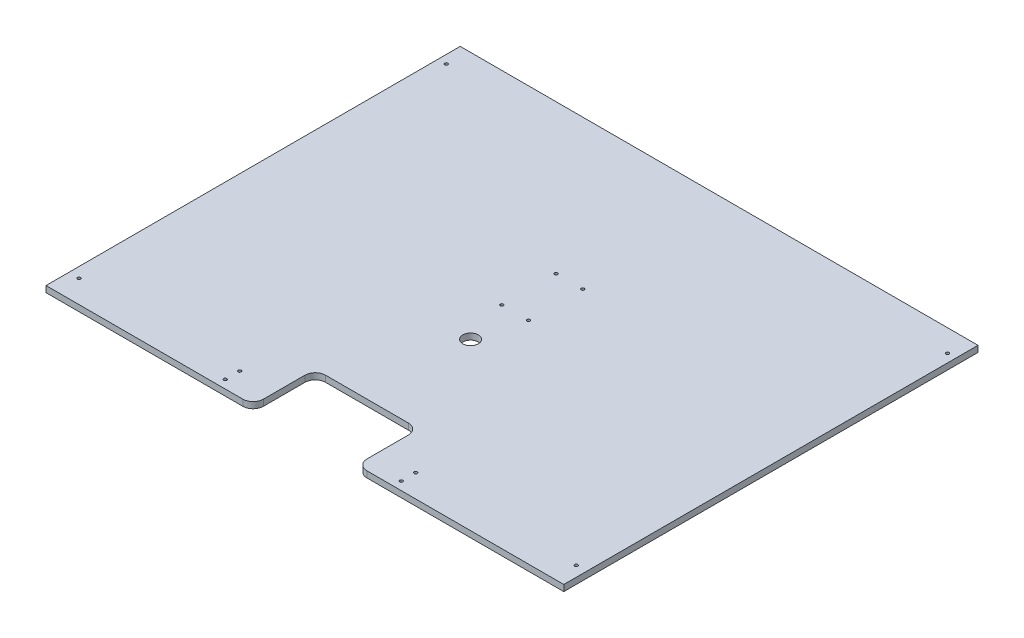
from build123d import *

# Parameters (mm, degrees)
SKETCH1_W           = 500
SKETCH1_H           = 400
SKETCH1_R           = 1.5
BOSS_EXTRUDE1_DEPTH = 6
SKETCH2_R           = 1.5
CUT_EXTRUDE1_DEPTH  = 10
SKETCH3_R           = 7.5
SKETCH3_W           = 100
SKETCH3_H           = 60
CUT_EXTRUDE2_DEPTH  = 641.340534403
FILLET1_R           = 10


with BuildPart() as part:
    # Sketch1 → Boss-Extrude1 (new body)
    with BuildSketch(Plane(origin=(0, 0, 0), x_dir=(1, 0, 0), z_dir=(0, 1, 0))):
        with Locations((250, -200)):
            Rectangle(SKETCH1_W, SKETCH1_H)
        with Locations((490, -378)):
            Circle(SKETCH1_R, mode=Mode.SUBTRACT)
        with Locations((10, -378)):
            Circle(SKETCH1_R, mode=Mode.SUBTRACT)
        with Locations((236.4, -196.155149351)):
            Circle(SKETCH1_R, mode=Mode.SUBTRACT)
        with Locations((262.1, -196.155149351)):
            Circle(SKETCH1_R, mode=Mode.SUBTRACT)
        with Locations((262.1, -143.855149351)):
            Circle(SKETCH1_R, mode=Mode.SUBTRACT)
        with Locations((236.4, -143.855149351)):
            Circle(SKETCH1_R, mode=Mode.SUBTRACT)
        with Locations((492, -21.5)):
            Circle(SKETCH1_R, mode=Mode.SUBTRACT)
        with Locations((8, -21.5)):
            Circle(SKETCH1_R, mode=Mode.SUBTRACT)
    extrude(amount=BOSS_EXTRUDE1_DEPTH)

    # Sketch2 → Cut-Extrude1 (cut)
    with BuildSketch(Plane(origin=(0, 6, 0), x_dir=(1, 0, 0), z_dir=(0, 1, 0))):
        with Locations((165, -378)):
            Circle(SKETCH2_R)
        with Locations((165, -392)):
            Circle(SKETCH2_R)
        with Locations((335, -378)):
            Circle(SKETCH2_R)
        with Locations((335, -392)):
            Circle(SKETCH2_R)
    extrude(amount=-CUT_EXTRUDE1_DEPTH, mode=Mode.SUBTRACT)

    # Sketch3 → Cut-Extrude2 (cut, through all)
    with BuildSketch(Plane.XZ):
        with Locations((250, 240)):
            Circle(SKETCH3_R)
        with Locations((250, 370)):
            Rectangle(SKETCH3_W, SKETCH3_H)
    extrude(amount=-CUT_EXTRUDE2_DEPTH, mode=Mode.SUBTRACT)

    # Fillet1
    fillet1_edges = [part.edges().sort_by_distance(p)[0] for p in [
        (200, 3, 400),
        (300, 3, 400),
        (200, 3, 340),
        (300, 3, 340),
    ]]
    fillet(fillet1_edges, radius=FILLET1_R)


solid = part.part
